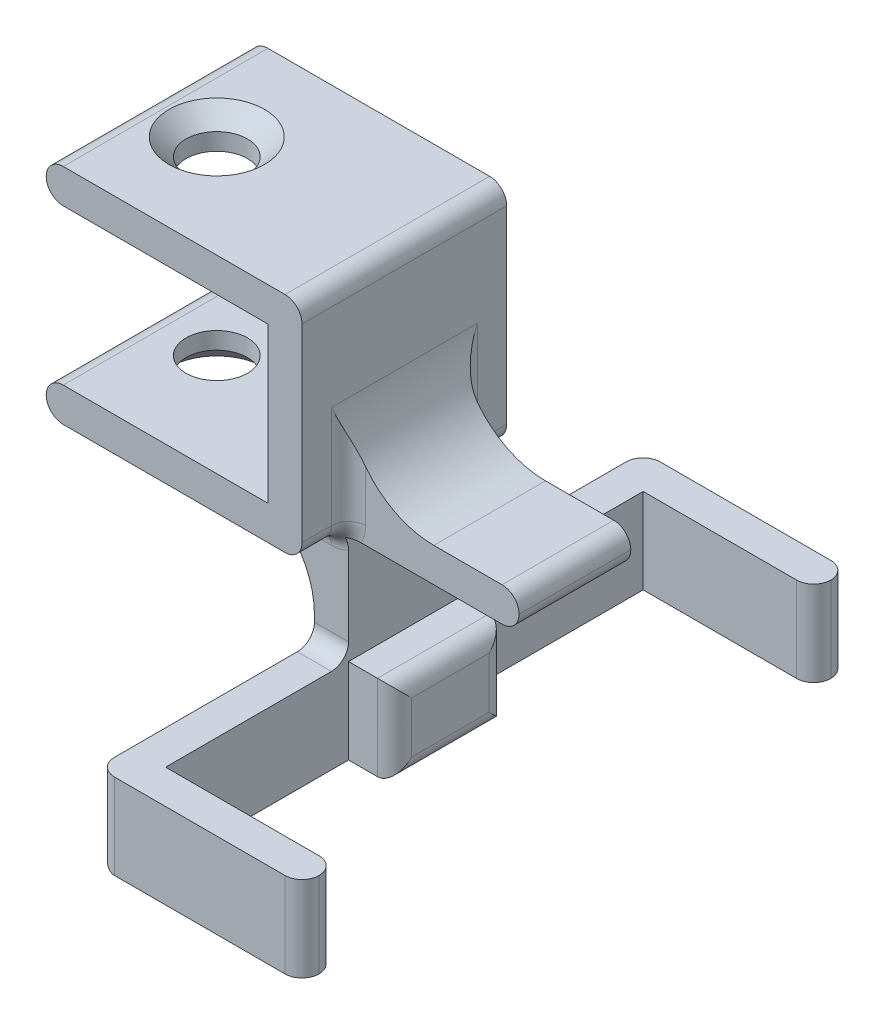
from build123d import *

# Parameters (mm, degrees)
SKETCH1_W               = 10
SKETCH1_H               = 2
BOSS_EXTRUDE1_DEPTH     = 3.275
BOSS_EXTRUDE2_DEPTH     = 6
SKETCH3_W               = 2
SKETCH3_H               = 5
BOSS_EXTRUDE3_DEPTH     = 16
SKETCH4_W               = 2
SKETCH4_H               = 5
BOSS_EXTRUDE4_DEPTH     = 10
FILLET1_R               = 1
FILLET2_R               = 1
CUT_EXTRUDE1_DEPTH      = 33.01952537
CUT_EXTRUDE1_DEPTH_BACK = 33.01952537
SKETCH2_R               = 1.8
CHAMFER1_SIZE           = 1
FILLET3_R               = 5


with BuildPart() as part:
    # Sketch1 → Boss-Extrude1 (new, symmetric)
    with BuildSketch(Plane.XY):
        Polygon((0, -9.1), (-13, -9.1), (-13, -11.1), (2, -11.1), (2, 2), (-13, 2), (-13, 0), (0, 0), align=None)
        Polygon((2, -11.1), (0, -11.1), (0, -22.5), (4.7, -22.5), (4.7, -17.5), (2, -17.5), align=None)
        with Locations((7, -10.1)):
            Rectangle(SKETCH1_W, SKETCH1_H)
    extrude(amount=BOSS_EXTRUDE1_DEPTH, both=True)

    # Sketch1<3> → Boss-Extrude2 (add, symmetric)
    with BuildSketch(Plane.XY):
        Polygon((0, -9.1), (-13, -9.1), (-13, -11.1), (2, -11.1), (2, 2), (-13, 2), (-13, 0), (0, 0), align=None)
    extrude(amount=BOSS_EXTRUDE2_DEPTH, both=True)

    # Sketch3 → Boss-Extrude3 (add, symmetric)
    with BuildSketch(Plane.XY):
        with Locations((1, -20)):
            Rectangle(SKETCH3_W, SKETCH3_H)
    extrude(amount=BOSS_EXTRUDE3_DEPTH, both=True)

    # Sketch4 → Boss-Extrude4 (add)
    with BuildSketch(Plane(origin=(2, 0, 0), x_dir=(0, 0, -1), z_dir=(1, 0, 0))):
        with Locations((-15, -20)):
            Rectangle(SKETCH4_W, SKETCH4_H)
        with Locations((15, -20)):
            Rectangle(SKETCH4_W, SKETCH4_H)
    extrude(amount=BOSS_EXTRUDE4_DEPTH)

    # Fillet1
    # the kernel refuses this fillet: 1 mm, written as the material it adds along each edge
    with BuildSketch(Plane(origin=(2, -17.5, 3.275), x_dir=(0, 1, 0), z_dir=(-1, 0, 0)), Plane(origin=(2, -17.5, -3.275), x_dir=(0, 0, -1), z_dir=(-1, 0, 0))) as fillet1_piece_1:
        with BuildLine():
            CenterArc((FILLET1_R, -FILLET1_R), FILLET1_R, 90, 90)
            Line((0, -FILLET1_R), (0, 0))
            Line((0, 0), (FILLET1_R, 0))
        make_face()
    extrude(amount=2)
    # the kernel refuses this fillet: 1 mm, written as the material it takes off along each edge
    with BuildSketch(Plane(origin=(-13, -9.1, -8.5), x_dir=(1, 0, 0), z_dir=(0, 0, 1)), Plane(origin=(-13, -11.1, -8.5), x_dir=(0, 1, 0), z_dir=(0, 0, 1)), Plane(origin=(2, 2, -8.5), x_dir=(0, -1, 0), z_dir=(0, 0, 1)), Plane(origin=(-13, 2, -8.5), x_dir=(1, 0, 0), z_dir=(0, 0, 1))) as fillet1_2_piece_1:
        with BuildLine():
            CenterArc((FILLET1_R, -FILLET1_R), FILLET1_R, 90, 90)
            Line((0, -FILLET1_R), (0, 0))
            Line((0, 0), (FILLET1_R, 0))
        make_face()
    extrude(amount=17, mode=Mode.SUBTRACT)
    with BuildSketch(Plane(origin=(2, -11.1, -8.5), x_dir=(-1, 0, 0), z_dir=(0, 0, 1)), Plane(origin=(2, -11.1, 3.275), x_dir=(-1, 0, 0), z_dir=(0, 0, 1))) as fillet1_2_piece_2:
        with BuildLine():
            CenterArc((FILLET1_R, -FILLET1_R), FILLET1_R, 90, 90)
            Line((0, -FILLET1_R), (0, 0))
            Line((0, 0), (FILLET1_R, 0))
        make_face()
    extrude(amount=5.225, mode=Mode.SUBTRACT)
    with BuildSketch(Plane(origin=(12, -15, 14), x_dir=(-1, 0, 0), z_dir=(0, -1, 0)), Plane(origin=(12, -15, -14), x_dir=(0, 0, -1), z_dir=(0, -1, 0)), Plane(origin=(0, -15, -16), x_dir=(0, 0, 1), z_dir=(0, -1, 0)), Plane(origin=(12, -25, 16), x_dir=(-1, 0, 0), z_dir=(0, 1, 0))) as fillet1_2_piece_3:
        with BuildLine():
            CenterArc((FILLET1_R, -FILLET1_R), FILLET1_R, 90, 90)
            Line((0, -FILLET1_R), (0, 0))
            Line((0, 0), (FILLET1_R, 0))
        make_face()
    extrude(amount=10, mode=Mode.SUBTRACT)
    with BuildSketch(Plane(origin=(0, -22.5, -18.5), x_dir=(0, 1, 0), z_dir=(0, 0, 1))) as fillet1_2_piece_4:
        with BuildLine():
            CenterArc((FILLET1_R, -FILLET1_R), FILLET1_R, 90, 90)
            Line((0, -FILLET1_R), (0, 0))
            Line((0, 0), (FILLET1_R, 0))
        make_face()
    extrude(amount=37, mode=Mode.SUBTRACT)
    with BuildSketch(Plane(origin=(4.7, -22.5, -5.775), x_dir=(-1, 0, 0), z_dir=(0, 0, 1)), Plane(origin=(4.7, -17.5, 5.775), x_dir=(-1, 0, 0), z_dir=(0, 0, -1))) as fillet1_2_piece_5:
        with BuildLine():
            CenterArc((FILLET1_R, -FILLET1_R), FILLET1_R, 90, 90)
            Line((0, -FILLET1_R), (0, 0))
            Line((0, 0), (FILLET1_R, 0))
        make_face()
    extrude(amount=11.55, mode=Mode.SUBTRACT)
    with BuildSketch(Plane(origin=(4.7, -25, 3.275), x_dir=(0, 0, -1), z_dir=(0, 1, 0)), Plane(origin=(4.7, -25, -3.275), x_dir=(-1, 0, 0), z_dir=(0, 1, 0)), Plane(origin=(12, -25, -16), x_dir=(-1, 0, 0), z_dir=(0, 1, 0)), Plane(origin=(0, -15, 16), x_dir=(0, 0, -1), z_dir=(0, -1, 0))) as fillet1_2_piece_6:
        with BuildLine():
            CenterArc((FILLET1_R, FILLET1_R), FILLET1_R, 180, 90)
            Line((0, FILLET1_R), (0, 0))
            Line((0, 0), (FILLET1_R, 0))
        make_face()
    extrude(amount=10, mode=Mode.SUBTRACT)
    with BuildSketch(Plane(origin=(12, -11.1, -5.775), x_dir=(0, 1, 0), z_dir=(0, 0, 1)), Plane(origin=(12, -9.1, -5.775), x_dir=(-1, 0, 0), z_dir=(0, 0, 1))) as fillet1_2_piece_7:
        with BuildLine():
            CenterArc((FILLET1_R, FILLET1_R), FILLET1_R, 180, 90)
            Line((0, FILLET1_R), (0, 0))
            Line((0, 0), (FILLET1_R, 0))
        make_face()
    extrude(amount=11.55, mode=Mode.SUBTRACT)
    with BuildSketch(Plane(origin=(-13, 0, 8.5), x_dir=(0, 1, 0), z_dir=(0, 0, -1))) as fillet1_2_piece_8:
        with BuildLine():
            CenterArc((FILLET1_R, FILLET1_R), FILLET1_R, 180, 90)
            Line((0, FILLET1_R), (0, 0))
            Line((0, 0), (FILLET1_R, 0))
        make_face()
    extrude(amount=17, mode=Mode.SUBTRACT)

    # Fillet2
    # the kernel refuses this fillet: 1 mm, written as the material it adds along each edge
    with BuildSketch(Plane(origin=(1, -10.1, -3.275), x_dir=(0, -1, 0), z_dir=(-1, 0, 0))) as fillet2_piece_1_section:
        with BuildLine():
            CenterArc((1 + FILLET2_R, -FILLET2_R), FILLET2_R, 90, 90)
            Line((1, -FILLET2_R), (1, 0))
            Line((1, 0), (1 + FILLET2_R, 0))
        make_face()
    fillet2_piece_1 = revolve(axis=Axis((1, -10.1, -3.275), (0, 0, 1)), revolution_arc=90, mode=Mode.PRIVATE)
    fillet2_piece_1 = split(fillet2_piece_1, bisect_by=Plane(origin=(2, -11.34730941, -3.421981112), z_dir=(-1, 0, 0)), keep=Keep.TOP, mode=Mode.PRIVATE)
    fillet2_piece_1 = split(fillet2_piece_1, bisect_by=Plane(origin=(1.400007142, -11.1, -3.421981112), z_dir=(0, -1, 0)), keep=Keep.TOP, mode=Mode.PRIVATE)
    add(fillet2_piece_1)
    with BuildSketch(Plane(origin=(1, -10.1, -3.275), x_dir=(0, -1, 0), z_dir=(-1, 0, 0))) as fillet2_piece_2_section:
        with BuildLine():
            CenterArc((1 + FILLET2_R, -FILLET2_R), FILLET2_R, 90, 90)
            Line((1, -FILLET2_R), (1, 0))
            Line((1, 0), (1 + FILLET2_R, 0))
        make_face()
    fillet2_piece_2 = revolve(axis=Axis((1, -10.1, -3.275), (0, 0, 1)), revolution_arc=90, mode=Mode.PRIVATE)
    fillet2_piece_2 = split(fillet2_piece_2, bisect_by=Plane(origin=(2, -10.826426326, -3.613950845), z_dir=(-1, 0, 0)), keep=Keep.TOP, mode=Mode.PRIVATE)
    fillet2_piece_2 = split(fillet2_piece_2, bisect_by=Plane(origin=(1.726426326, -11.1, -3.613950845), z_dir=(0, 1, 0)), keep=Keep.TOP, mode=Mode.PRIVATE)
    add(fillet2_piece_2)
    with BuildSketch(Plane(origin=(1, -10.1, -3.275), x_dir=(0, -1, 0), z_dir=(-1, 0, 0))) as fillet2_piece_3_section:
        with BuildLine():
            CenterArc((1 + FILLET2_R, -FILLET2_R), FILLET2_R, 90, 90)
            Line((1, -FILLET2_R), (1, 0))
            Line((1, 0), (1 + FILLET2_R, 0))
        make_face()
    fillet2_piece_3 = revolve(axis=Axis((1, -10.1, -3.275), (0, 0, 1)), revolution_arc=90, mode=Mode.PRIVATE)
    fillet2_piece_3 = split(fillet2_piece_3, bisect_by=Plane(origin=(2, -10.500007075, -3.421981186), z_dir=(1, 0, 0)), keep=Keep.TOP, mode=Mode.PRIVATE)
    fillet2_piece_3 = split(fillet2_piece_3, bisect_by=Plane(origin=(2.24730905, -11.1, -3.421981186), z_dir=(0, 1, 0)), keep=Keep.TOP, mode=Mode.PRIVATE)
    add(fillet2_piece_3)
    with BuildSketch(Plane(origin=(1, -10.1, 3.275), x_dir=(0, -1, 0), z_dir=(-1, 0, 0))) as fillet2_piece_4_section:
        with BuildLine():
            CenterArc((1 + FILLET2_R, FILLET2_R), FILLET2_R, 180, 90)
            Line((1, FILLET2_R), (1, 0))
            Line((1, 0), (1 + FILLET2_R, 0))
        make_face()
    fillet2_piece_4 = revolve(axis=Axis((1, -10.1, 3.275), (0, 0, 1)), revolution_arc=90, mode=Mode.PRIVATE)
    fillet2_piece_4 = split(fillet2_piece_4, bisect_by=Plane(origin=(2, -11.34730941, 3.421981112), z_dir=(-1, 0, 0)), keep=Keep.TOP, mode=Mode.PRIVATE)
    fillet2_piece_4 = split(fillet2_piece_4, bisect_by=Plane(origin=(1.400007142, -11.1, 3.421981112), z_dir=(0, -1, 0)), keep=Keep.TOP, mode=Mode.PRIVATE)
    add(fillet2_piece_4)
    with BuildSketch(Plane(origin=(1, -10.1, 3.275), x_dir=(0, -1, 0), z_dir=(-1, 0, 0))) as fillet2_piece_5_section:
        with BuildLine():
            CenterArc((1 + FILLET2_R, FILLET2_R), FILLET2_R, 180, 90)
            Line((1, FILLET2_R), (1, 0))
            Line((1, 0), (1 + FILLET2_R, 0))
        make_face()
    fillet2_piece_5 = revolve(axis=Axis((1, -10.1, 3.275), (0, 0, 1)), revolution_arc=90, mode=Mode.PRIVATE)
    fillet2_piece_5 = split(fillet2_piece_5, bisect_by=Plane(origin=(2, -10.826426326, 3.613950845), z_dir=(-1, 0, 0)), keep=Keep.TOP, mode=Mode.PRIVATE)
    fillet2_piece_5 = split(fillet2_piece_5, bisect_by=Plane(origin=(1.726426326, -11.1, 3.613950845), z_dir=(0, 1, 0)), keep=Keep.TOP, mode=Mode.PRIVATE)
    add(fillet2_piece_5)
    with BuildSketch(Plane(origin=(1, -10.1, 3.275), x_dir=(0, -1, 0), z_dir=(-1, 0, 0))) as fillet2_piece_6_section:
        with BuildLine():
            CenterArc((1 + FILLET2_R, FILLET2_R), FILLET2_R, 180, 90)
            Line((1, FILLET2_R), (1, 0))
            Line((1, 0), (1 + FILLET2_R, 0))
        make_face()
    fillet2_piece_6 = revolve(axis=Axis((1, -10.1, 3.275), (0, 0, 1)), revolution_arc=90, mode=Mode.PRIVATE)
    fillet2_piece_6 = split(fillet2_piece_6, bisect_by=Plane(origin=(2, -10.500007075, 3.421981186), z_dir=(1, 0, 0)), keep=Keep.TOP, mode=Mode.PRIVATE)
    fillet2_piece_6 = split(fillet2_piece_6, bisect_by=Plane(origin=(2.24730905, -11.1, 3.421981186), z_dir=(0, 1, 0)), keep=Keep.TOP, mode=Mode.PRIVATE)
    add(fillet2_piece_6)
    with BuildSketch(Plane(origin=(0, -11.1, 3.275), x_dir=(0, -1, 0), z_dir=(1, 0, 0)), Plane(origin=(2, -10.1, 3.275), x_dir=(1, 0, 0), z_dir=(0, 1, 0)), Plane(origin=(0, -11.1, -3.275), x_dir=(0, 0, -1), z_dir=(1, 0, 0)), Plane(origin=(2, -10.1, -3.275), x_dir=(0, 0, -1), z_dir=(0, 1, 0))) as fillet2_piece_7:
        with BuildLine():
            CenterArc((FILLET2_R, -FILLET2_R), FILLET2_R, 90, 90)
            Line((0, -FILLET2_R), (0, 0))
            Line((0, 0), (FILLET2_R, 0))
        make_face()
    extrude(amount=1)

    # Sketch2 → Cut-Extrude1 (cut, two sides: drawn at the far end of the back side and taken through both)
    with BuildSketch(Plane(origin=(0, 2, 0), x_dir=(1, 0, 0), z_dir=(0, 1, 0)).offset(-CUT_EXTRUDE1_DEPTH_BACK)):
        with Locations((-9, 0)):
            Circle(SKETCH2_R)
    extrude(amount=CUT_EXTRUDE1_DEPTH + CUT_EXTRUDE1_DEPTH_BACK, mode=Mode.SUBTRACT)

    # Chamfer1
    chamfer1_edges = [part.edges().sort_by_distance(p)[0] for p in [
        (-10.8, -11.1, 0),
        (-10.8, 2, 0),
    ]]
    chamfer(chamfer1_edges, length=CHAMFER1_SIZE)

    # Fillet3
    fillet3_edges = [part.edges().sort_by_distance(p)[0] for p in [
        (0, -11.1, 0),
        (2, -9.1, 0),
    ]]
    fillet(fillet3_edges, radius=FILLET3_R)


solid = part.part
